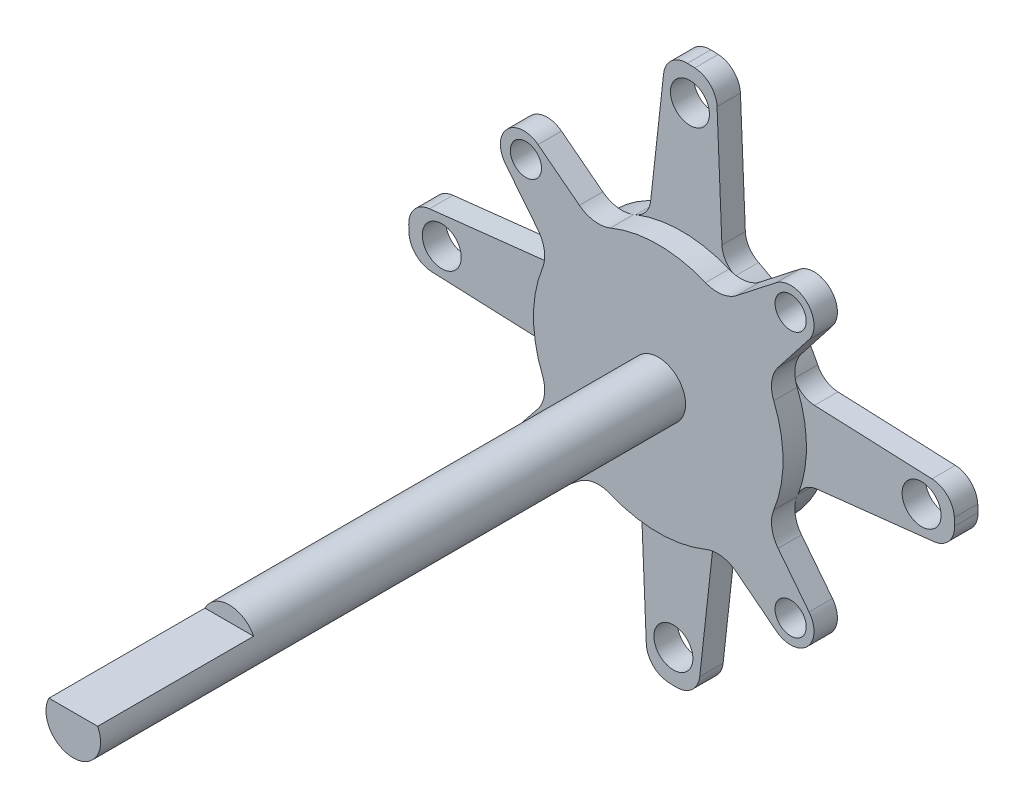
from build123d import *

# Parameters (mm, degrees)
SKETCH_2_R          = 3.5
EXTRUDE_1_DEPTH     = 75
SKETCH_3_R          = 2
EXTRUDE_2_DEPTH     = 3
FILLET_1_R          = 5
SKETCH_5_R          = 16
EXTRUDE_3_DEPTH     = 3
FILLET_2_R          = 4
SKETCH_6_R          = 2.5
EXTRUDE_4_DEPTH     = 3
FILLET_3_R          = 3
FILLET_4_R          = 3
CUT_EXTRUDE_1_DEPTH = 20


with BuildPart() as part:
    # 草图2 → 凸台-拉伸1 (new body)
    with BuildSketch(Plane.XY):
        Circle(SKETCH_2_R)
    extrude(amount=-EXTRUDE_1_DEPTH)

    # 草图3 → 凸台-拉伸2 (add)
    with BuildSketch(Plane(origin=(0, 0, -75), x_dir=(-1, 0, 0), z_dir=(0, 0, -1))):
        with BuildLine():
            Line((-19.333172355, 15.121758852), (-7.5, 0))
            Line((-7.5, 0), (-19.333172355, -15.121758852))
            ThreePointArc((-19.333172355, -15.121758852), (-19.091883092, -19.091883092), (-15.121758852, -19.333172355))
            Line((-15.121758852, -19.333172355), (0, -7.5))
            Line((0, -7.5), (15.407660085, -19.397223244))
            ThreePointArc((15.407660085, -19.397223244), (19.379165256, -19.127226562), (19.586420792, -15.151953404))
            Line((19.586420792, -15.151953404), (7.5, 0))
            Line((7.5, 0), (19.586420792, 15.151953404))
            ThreePointArc((19.586420792, 15.151953404), (19.379165256, 19.127226562), (15.407660085, 19.397223244))
            Line((15.407660085, 19.397223244), (0, 7.5))
            Line((0, 7.5), (-15.121758852, 19.333172355))
            ThreePointArc((-15.121758852, 19.333172355), (-19.091883092, 19.091883092), (-19.333172355, 15.121758852))
        make_face()
        with Locations((-16.970562748, 16.970562748)):
            Circle(SKETCH_3_R, mode=Mode.SUBTRACT)
        with Locations((16.970562748, 16.970562748)):
            Circle(SKETCH_3_R, mode=Mode.SUBTRACT)
        with Locations((16.970562748, -16.970562748)):
            Circle(SKETCH_3_R, mode=Mode.SUBTRACT)
        with Locations((-16.970562748, -16.970562748)):
            Circle(SKETCH_3_R, mode=Mode.SUBTRACT)
    extrude(amount=EXTRUDE_2_DEPTH)

    # 圆角1
    fillet_1_edges = [part.edges().sort_by_distance(p)[0] for p in [
        (7.5, 0, -76.5),
        (0, -7.5, -76.5),
        (-7.5, 0, -76.5),
        (0, 7.5, -76.5),
    ]]
    fillet(fillet_1_edges, radius=FILLET_1_R)

    # 草图5 → 凸台-拉伸3 (add)
    with BuildSketch(Plane.XY.offset(-75)):
        Circle(SKETCH_5_R)
    extrude(amount=-EXTRUDE_3_DEPTH)

    # 圆角2
    fillet_2_edges = [part.edges().sort_by_distance(p)[0] for p in [
        (8.070562783, -13.815426753, -76.5),
        (13.815426753, -8.070562783, -76.5),
        (-8.132091519, -13.779299239, -76.5),
        (-13.866910674, -7.981778521, -76.5),
        (-13.866910674, 7.981778521, -76.5),
        (-8.132091519, 13.779299239, -76.5),
        (8.070562783, 13.815426753, -76.5),
        (13.815426753, 8.070562783, -76.5),
    ]]
    fillet(fillet_2_edges, radius=FILLET_2_R)

    # 草图6 → 凸台-拉伸4 (add)
    with BuildSketch(Plane(origin=(0, 0, -78), x_dir=(-1, 0, 0), z_dir=(0, 0, -1))):
        with BuildLine():
            Line((-4.536268833, 32.087497482), (-5.241257707, 15.117182861))
            ThreePointArc((-5.241257707, 15.117182861), (-11.313708499, 11.313708499), (-15.117182861, 5.241257707))
            Line((-15.117182861, 5.241257707), (-32.087497482, 4.536268833))
            ThreePointArc((-32.087497482, 4.536268833), (-34.077297457, 3.667151814), (-34.959506593, 1.683121729))
            ThreePointArc((-34.959506593, 1.683121729), (-34.979209977, 1.206179654), (-34.992406887, 0.729013218))
            ThreePointArc((-34.992406887, 0.729013218), (-34.248960415, -1.311073956), (-32.323754723, -2.31519117))
            Line((-32.323754723, -2.31519117), (-15.442311817, -4.187482029))
            ThreePointArc((-15.442311817, -4.187482029), (-11.313708499, -11.313708499), (-4.187482029, -15.442311817))
            Line((-4.187482029, -15.442311817), (-2.31519117, -32.323754723))
            ThreePointArc((-2.31519117, -32.323754723), (-1.311073956, -34.248960415), (0.729013218, -34.992406887))
            ThreePointArc((0.729013218, -34.992406887), (1.206179654, -34.979209977), (1.683121729, -34.959506593))
            ThreePointArc((1.683121729, -34.959506593), (3.667151814, -34.077297457), (4.536268833, -32.087497482))
            Line((4.536268833, -32.087497482), (5.241257707, -15.117182861))
            ThreePointArc((5.241257707, -15.117182861), (11.313708499, -11.313708499), (15.117182861, -5.241257707))
            Line((15.117182861, -5.241257707), (32.087497482, -4.536268833))
            ThreePointArc((32.087497482, -4.536268833), (34.077297457, -3.667151814), (34.959506593, -1.683121729))
            ThreePointArc((34.959506593, -1.683121729), (34.979209977, -1.206179654), (34.992406887, -0.729013218))
            ThreePointArc((34.992406887, -0.729013218), (34.248960415, 1.311073956), (32.323754723, 2.31519117))
            Line((32.323754723, 2.31519117), (15.442311817, 4.187482029))
            ThreePointArc((15.442311817, 4.187482029), (11.313708499, 11.313708499), (4.187482029, 15.442311817))
            Line((4.187482029, 15.442311817), (2.31519117, 32.323754723))
            ThreePointArc((2.31519117, 32.323754723), (1.311073956, 34.248960415), (-0.729013218, 34.992406887))
            ThreePointArc((-0.729013218, 34.992406887), (-1.206179654, 34.979209977), (-1.683121729, 34.959506593))
            ThreePointArc((-1.683121729, 34.959506593), (-3.667151814, 34.077297457), (-4.536268833, 32.087497482))
        make_face()
        with Locations((-1.060660172, 30.759144982)):
            Circle(SKETCH_6_R, mode=Mode.SUBTRACT)
        with Locations(Location((30.759144982, -1.060660172, 0), (0, 0, 180))):
            Circle(SKETCH_6_R, mode=Mode.SUBTRACT)
        with Locations((1.060660172, -30.759144982)):
            Circle(SKETCH_6_R, mode=Mode.SUBTRACT)
        with Locations(Location((-30.759144982, 1.060660172, 0), (0, 0, 180))):
            Circle(SKETCH_6_R, mode=Mode.SUBTRACT)
    extrude(amount=EXTRUDE_4_DEPTH)

    # 圆角3
    # the kernel refuses this fillet: 3 mm, written as the material it adds along each edge
    with BuildSketch(Plane(origin=(5.241257707, 15.117182861, -78), x_dir=(0.9253660102129004, -0.379074856911743, 0), z_dir=(0, 0, -1))) as fillet_3_piece_1:
        with BuildLine():
            CenterArc((1.926011056, -2.995454288), FILLET_3_R, 93.154516435, 62.190253948)
            Line((-0.800492197, -1.743983149), (0, 0))
            ThreePointArc((0, 0), (0.880462197, -0.024243795), (1.760924394, 0))
        make_face()
    extrude(amount=3)

    # 圆角4
    # the kernel refuses this fillet: 3 mm, written as the material it adds along each edge
    with BuildSketch(Plane(origin=(15.117182861, 5.241257707, -78), x_dir=(-0.379074856911857, 0.9253660102128536, 0), z_dir=(0, 0, -1)), Plane(origin=(4.187482029, -15.442311817, -78), x_dir=(0.9492800359617337, 0.3144318898020519, 0), z_dir=(0, 0, -1)), Plane(origin=(-15.117182861, -5.241257707, -78), x_dir=(0.3790748569116308, -0.9253660102129463, 0), z_dir=(0, 0, -1)), Plane(origin=(-4.187482029, 15.442311817, -78), x_dir=(-0.9492800359616571, -0.3144318898022824, 0), z_dir=(0, 0, -1))) as fillet_4_piece_1:
        with BuildLine():
            CenterArc((1.926011056, 2.995454288), FILLET_4_R, 204.655229617, 62.190253948)
            Line((-0.800492197, 1.743983149), (0, 0))
            ThreePointArc((0, 0), (0.880462197, 0.024243795), (1.760924394, 0))
        make_face()
    extrude(amount=3)
    with BuildSketch(Plane(origin=(15.442311817, -4.187482029, -78), x_dir=(-0.314431889802168, -0.9492800359616952, 0), z_dir=(0, 0, -1))) as fillet_4_piece_2:
        with BuildLine():
            CenterArc((1.926011056, -2.995454288), FILLET_4_R, 93.154516435, 62.190253948)
            Line((-0.800492197, -1.743983149), (0, 0))
            ThreePointArc((0, 0), (0.880462197, -0.024243795), (1.760924394, 0))
        make_face()
    extrude(amount=3)
    with BuildSketch(Plane(origin=(-5.241257707, -15.117182861, -78), x_dir=(0.04150667502361383, -0.999138226637578, 0), z_dir=(0, 0, -1)), Plane(origin=(-15.442311817, 4.187482029, -78), x_dir=(-0.9939058470596024, -0.11023233273742473, 0), z_dir=(0, 0, -1))) as fillet_4_piece_3:
        with BuildLine():
            CenterArc((1.91892287, 3), FILLET_4_R, 207.809746052, 62.190253948)
            ThreePointArc((-0.734582019, 1.600388696), (-0.345257414, 0.810307818), (0, 0))
            Line((0, 0), (1.91892287, 0))
        make_face()
    extrude(amount=3)

    # 草图8 → 切除-拉伸1 (cut)
    with BuildSketch(Plane.XY):
        Polygon((-3.12402203, 1.578127484), (3.12402203, 1.578127484), (3.250549132, 4.217874186), (-3.12402203, 4.393016319), align=None)
    extrude(amount=-CUT_EXTRUDE_1_DEPTH, mode=Mode.SUBTRACT)


solid = part.part
